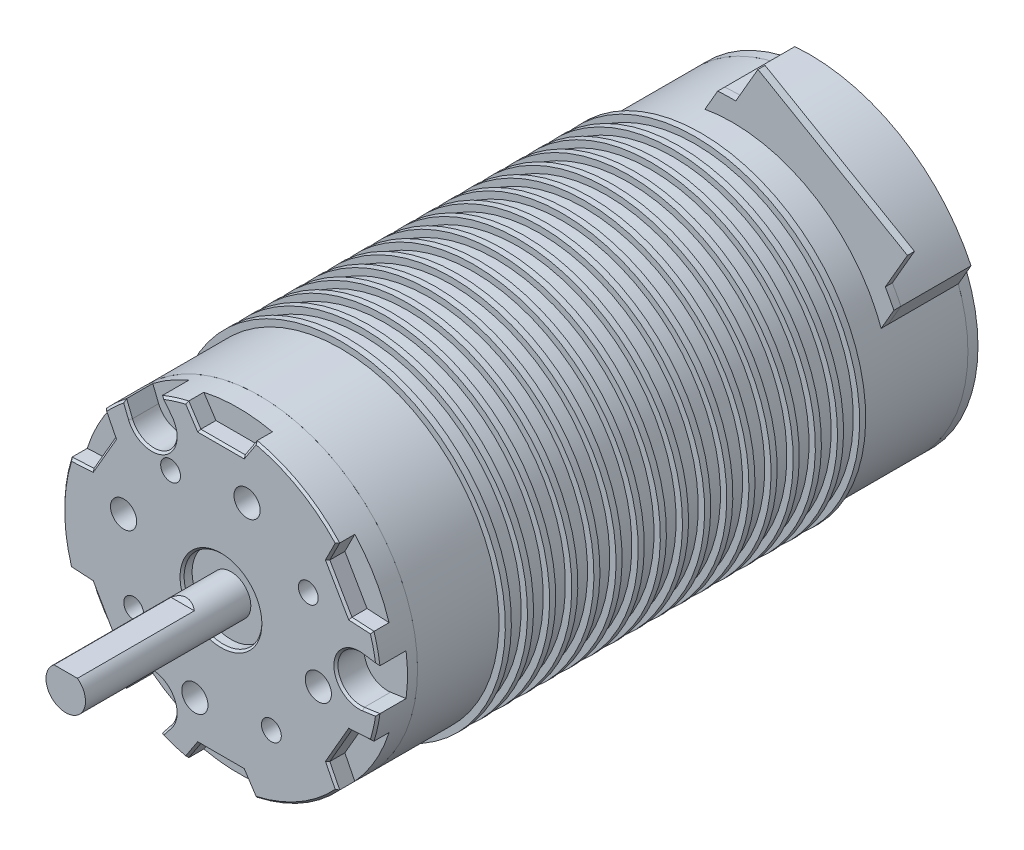
from build123d import *

# Parameters (mm, degrees)
SKETCH1_R                      = 19.939
BOSS_EXTRUDE1_DEPTH            = 69.342
SKETCH2_R                      = 19.939
BOSS_EXTRUDE2_DEPTH            = 1.27
SKETCH4_R                      = 19.939
BOSS_EXTRUDE3_DEPTH            = 4.826
CUT_EXTRUDE1_START             = -2.159
CUT_EXTRUDE1_DEPTH             = 2.159
CIRPATTERN1_COUNT              = 6
CUT_EXTRUDE2_START             = -3.556
CUT_EXTRUDE2_DEPTH             = 3.556
CIRPATTERN2_COUNT              = 3
SKETCH7_W                      = 0.762
SKETCH7_H                      = 0.8001
SKETCH8_R                      = 4.9022
CUT_EXTRUDE3_DEPTH             = 1.27
SKETCH9_R                      = 2.4892
BOSS_EXTRUDE4_DEPTH            = 20.828
CUT_EXTRUDE4_DEPTH             = 15.24
CHAMFER2_SIZE                  = 0.508
CHAMFER2_SIZE_2                = 0.526049399
CHAMFER3_SIZE                  = 0.254
CHAMFER3_SIZE2                 = 0.2630247
SKETCH12_W                     = 8.8392
SKETCH12_H                     = 2.54
REVOLVE2_ANGLE                 = 40
REVOLVE2_OTHER_WAY_ANGLE       = 40
CUT_EXTRUDE5_DEPTH             = 8.8392
BOSS_EXTRUDE5_DEPTH            = 0.889
M3X0_5_TAPPED_HOLE1_AT_2_COUNT = 2
M3X0_5_TAPPED_HOLE1_AT_2_PITCH = 17.960512242
M3X0_5_TAPPED_HOLE1_AT_3_COUNT = 2
M3X0_5_TAPPED_HOLE1_AT_3_PITCH = 25.4
M3X0_5_TAPPED_HOLE1_AT_4_COUNT = 2
M3X0_5_TAPPED_HOLE1_AT_4_PITCH = 17.960512242
M4X0_7_TAPPED_HOLE1_AT_2_COUNT = 2
M4X0_7_TAPPED_HOLE1_AT_2_PITCH = 17.960512242
M4X0_7_TAPPED_HOLE1_AT_3_COUNT = 2
M4X0_7_TAPPED_HOLE1_AT_3_PITCH = 25.4
M4X0_7_TAPPED_HOLE1_AT_4_COUNT = 2
M4X0_7_TAPPED_HOLE1_AT_4_PITCH = 17.960512242


with BuildPart() as part:
    # Sketch1 → Boss-Extrude1 (new body)
    with BuildSketch(Plane.XY):
        Circle(SKETCH1_R)
    extrude(amount=BOSS_EXTRUDE1_DEPTH)

    # Sketch7 → Revolve1 (revolve)
    with BuildSketch(Plane(origin=(0, 0, 0), x_dir=(0, 0, -1), z_dir=(1, 0, 0))):
        with Locations((-58.6994, 20.33905)):
            Rectangle(SKETCH7_W, SKETCH7_H)
        with Locations((-55.90936875, 20.33905)):
            Rectangle(SKETCH7_W, SKETCH7_H)
        with Locations((-53.1193375, 20.33905)):
            Rectangle(SKETCH7_W, SKETCH7_H)
        with Locations((-50.32930625, 20.33905)):
            Rectangle(SKETCH7_W, SKETCH7_H)
        with Locations((-47.539275, 20.33905)):
            Rectangle(SKETCH7_W, SKETCH7_H)
        with Locations((-44.74924375, 20.33905)):
            Rectangle(SKETCH7_W, SKETCH7_H)
        with Locations((-41.9592125, 20.33905)):
            Rectangle(SKETCH7_W, SKETCH7_H)
        with Locations((-39.16918125, 20.33905)):
            Rectangle(SKETCH7_W, SKETCH7_H)
        with Locations((-36.37915, 20.33905)):
            Rectangle(SKETCH7_W, SKETCH7_H)
        with Locations((-33.58911875, 20.33905)):
            Rectangle(SKETCH7_W, SKETCH7_H)
        with Locations((-30.7990875, 20.33905)):
            Rectangle(SKETCH7_W, SKETCH7_H)
        with Locations((-28.00905625, 20.33905)):
            Rectangle(SKETCH7_W, SKETCH7_H)
        with Locations((-25.219025, 20.33905)):
            Rectangle(SKETCH7_W, SKETCH7_H)
        with Locations((-22.42899375, 20.33905)):
            Rectangle(SKETCH7_W, SKETCH7_H)
        with Locations((-19.6389625, 20.33905)):
            Rectangle(SKETCH7_W, SKETCH7_H)
        with Locations((-16.84893125, 20.33905)):
            Rectangle(SKETCH7_W, SKETCH7_H)
        with Locations((-14.0589, 20.33905)):
            Rectangle(SKETCH7_W, SKETCH7_H)
    revolve(axis=Axis((0, 0, -1.27), (0, 0, 1)))


with BuildPart() as body_2:
    # Sketch2 → Boss-Extrude2 (new body)
    with BuildSketch(Plane(origin=(0, 0, 0), x_dir=(-1, 0, 0), z_dir=(0, 0, -1))):
        Circle(SKETCH2_R)
    extrude(amount=BOSS_EXTRUDE2_DEPTH)


with BuildPart() as body_3:
    # Sketch4 → Boss-Extrude3 (new body)
    with BuildSketch(Plane.XY.offset(69.342)):
        Circle(SKETCH4_R)
    extrude(amount=BOSS_EXTRUDE3_DEPTH)

    # Sketch5 → Cut-Extrude1 (cut)
    with BuildSketch(Plane.XY.offset(74.168).offset(CUT_EXTRUDE1_START)):
        with BuildLine():
            Line((-4.318, 19.465831526), (-2.794, 17.145))
            Line((-2.794, 17.145), (2.794, 17.145))
            Line((2.794, 17.145), (4.318, 19.465831526))
            ThreePointArc((4.318, 19.465831526), (0, 19.939), (-4.318, 19.465831526))
        make_face()
    cut_extrude1 = extrude(amount=CUT_EXTRUDE1_DEPTH, mode=Mode.SUBTRACT)

    # CirPattern1: Cut-Extrude1 ×6 about axis
    cirpattern1_axis = Axis((0, 0, 0), (0, 0, 1))
    for i in range(1, CIRPATTERN1_COUNT):
        add(cut_extrude1.rotate(cirpattern1_axis, i * 360 / CIRPATTERN1_COUNT), mode=Mode.SUBTRACT)

    # Sketch6 → Cut-Extrude2 (cut)
    with BuildSketch(Plane.XY.offset(74.168).offset(CUT_EXTRUDE2_START)):
        with BuildLine():
            Line((-12.14695744, 15.81186725), (-11.409591897, 13.978185694))
            ThreePointArc((-11.409591897, 13.978185694), (-7.239, 12.538315796), (-6.400667962, 16.870089276))
            Line((-6.400667962, 16.870089276), (-7.62, 18.425507347))
            ThreePointArc((-7.62, 18.425507347), (-9.9695, 17.267680526), (-12.14695744, 15.81186725))
        make_face()
    cut_extrude2 = extrude(amount=CUT_EXTRUDE2_DEPTH, mode=Mode.SUBTRACT)

    # CirPattern2: Cut-Extrude2 ×3 about axis
    cirpattern2_axis = Axis((0, 0, 0), (0, 0, 1))
    for i in range(1, CIRPATTERN2_COUNT):
        add(cut_extrude2.rotate(cirpattern2_axis, i * 360 / CIRPATTERN2_COUNT), mode=Mode.SUBTRACT)

    # Sketch8 → Cut-Extrude3 (cut)
    with BuildSketch(Plane.XY.offset(74.168)):
        Circle(SKETCH8_R)
    extrude(amount=-CUT_EXTRUDE3_DEPTH, mode=Mode.SUBTRACT)

    # Sketch9 → Boss-Extrude4 (add)
    with BuildSketch(Plane.XY.offset(72.898)):
        Circle(SKETCH9_R)
    extrude(amount=BOSS_EXTRUDE4_DEPTH)

    # Sketch10 → Cut-Extrude4 (cut)
    with BuildSketch(Plane.XY.offset(93.726)):
        with BuildLine():
            Line((-1.472981018, 2.0066), (1.472981018, 2.0066))
            ThreePointArc((1.472981018, 2.0066), (0, 2.4892), (-1.472981018, 2.0066))
        make_face()
    extrude(amount=-CUT_EXTRUDE4_DEPTH, mode=Mode.SUBTRACT)

    # Chamfer2
    # the kernel refuses this chamfer: 0.526049399, 0.508 mm, written as the material it adds along each edge
    with BuildSketch(Plane(origin=(-2.826438745, 2.0066, 78.486), x_dir=(0, -0.028950429899542527, 0.9995808484603093), z_dir=(1, 0, 0))) as chamfer2_piece_1_section:
        Polygon((CHAMFER2_SIZE * 0.99958084846, -CHAMFER2_SIZE * 0.0289504298995), (-CHAMFER2_SIZE_2 * 0.0289504299219, -CHAMFER2_SIZE_2 * 0.999580849231), (0, 0), align=None)
    chamfer2_piece_1 = extrude(amount=5.65287749, mode=Mode.PRIVATE)
    chamfer2_piece_1 = chamfer2_piece_1 & Plane(origin=(0, 0, 78.670866415), x_dir=(1, 0, 0), z_dir=(0, 0, -1)) * Cylinder(2.4892, 14, mode=Mode.PRIVATE)
    add(chamfer2_piece_1)

    # Chamfer3
    chamfer3_edges = [body_3.edges().sort_by_distance(p)[0] for p in [
        (-5.991621617, -19.017470689, 74.168),
        (19.465423541, 4.319838814, 74.168),
        (-11.778274668, -14.895026472, 74.168),
        (-3.556, 18.305415763, 74.168),
        (-7.010333981, -17.647798312, 74.168),
        (-7.239, -12.538315796, 74.168),
        (0, 17.145, 74.168),
        (18.788608649, -2.752771839, 74.168),
        (3.556, 18.305415763, 74.168),
        (18.788608649, 2.752771839, 74.168),
        (14.478, 0, 74.168),
        (-4.9022, 0, 74.168),
        (-19.939, 0, 74.168),
        (-13.473801924, -14.697631874, 74.168),
        (9.9695, -17.267680526, 74.168),
        (19.465423541, -4.319838814, 74.168),
        (9.9695, 17.267680526, 74.168),
        (14.074955078, 12.232294217, 74.168),
        (14.848005548, 8.5725, 74.168),
        (17.630955078, 6.073121546, 74.168),
        (17.630955078, -6.073121546, 74.168),
        (14.848005548, -8.5725, 74.168),
        (14.074955078, -12.232294217, 74.168),
        (3.556, -18.305415763, 74.168),
        (0, -17.145, 74.168),
        (-3.556, -18.305415763, 74.168),
        (-14.074955078, -12.232294217, 74.168),
        (-14.848005548, -8.5725, 74.168),
        (-17.630955078, -6.073121546, 74.168),
        (-5.991621617, 19.017470689, 74.168),
        (-17.630955078, 6.073121546, 74.168),
        (-14.848005548, 8.5725, 74.168),
        (-14.074955078, 12.232294217, 74.168),
        (-13.473801924, 14.697631874, 74.168),
        (-7.010333981, 17.647798312, 74.168),
        (-11.778274668, 14.895026472, 74.168),
        (-7.239, 12.538315796, 74.168),
    ]]
    chamfer3_side = [body_3.faces().sort_by_distance(p)[0] for p in [
        (-4.020820912, 18.000185908, 74.168),
    ]]
    chamfer(chamfer3_edges, length=CHAMFER3_SIZE, length2=CHAMFER3_SIZE2, reference=chamfer3_side[0])


with BuildPart() as body_4:
    # Sketch12 → Revolve2 (revolve)
    with BuildSketch(Plane(origin=(0, 0, 0), x_dir=(0, 0, -1), z_dir=(0.8660254037844382, -0.500000000000001, 1.8914997310486246e-15))):
        with Locations((-4.4196, 21.209)):
            Rectangle(SKETCH12_W, SKETCH12_H)
    revolve(axis=Axis((0, 0, 0), (0, 0, 1)), revolution_arc=REVOLVE2_ANGLE)

    # Sketch12 → Revolve2 other way (revolve)
    with BuildSketch(Plane(origin=(0, 0, 0), x_dir=(0, 0, -1), z_dir=(0.8660254037844382, -0.500000000000001, 1.8914997310486246e-15))):
        with Locations((-4.4196, 21.209)):
            Rectangle(SKETCH12_W, SKETCH12_H)
    revolve(axis=Axis((0, 0, 0), (0, 0, -1)), revolution_arc=REVOLVE2_OTHER_WAY_ANGLE)

    # Sketch13 → Cut-Extrude5 (cut)
    with BuildSketch(Plane(origin=(0, 0, 0), x_dir=(-1, 0, 0), z_dir=(0, 0, -1))):
        with BuildLine():
            Line((-18.736531166, 6.819539638), (-20.333108117, 9.584892035))
            ThreePointArc((-20.333108117, 9.584892035), (-20.749910402, 8.645615034), (-21.123350423, 7.688270802))
            Line((-21.123350423, 7.688270802), (-18.736531166, 6.819539638))
        make_face()
        with BuildLine():
            Line((3.462371015, 19.636081787), (1.865794064, 22.401434184))
            ThreePointArc((1.865794064, 22.401434184), (2.88763295, 22.292757051), (3.903437386, 22.13749348))
            Line((3.903437386, 22.13749348), (3.462371015, 19.636081787))
        make_face()
    extrude(amount=-CUT_EXTRUDE5_DEPTH, mode=Mode.SUBTRACT)


with BuildPart() as body_5:
    # Sketch14 → Boss-Extrude5 (new body)
    with BuildSketch(Plane.XY.offset(8.8392)):
        with BuildLine():
            Line((-3.462371015, 19.636081787), (-1.865794064, 22.401434184))
            ThreePointArc((-1.865794064, 22.401434184), (-0.723731232, 22.467346397), (0.420205936, 22.475072146))
            Line((0.420205936, 22.475072146), (3.214205936, 27.314422102))
            Line((3.214205936, 27.314422102), (22.047880462, 16.440795045))
            Line((22.047880462, 16.440795045), (19.253880462, 11.601445089))
            ThreePointArc((19.253880462, 11.601445089), (19.819158351, 10.606903566), (20.333108117, 9.584892035))
            Line((20.333108117, 9.584892035), (18.736531166, 6.819539638))
            ThreePointArc((18.736531166, 6.819539638), (9.9695, 17.267680526), (-3.462371015, 19.636081787))
        make_face()
    extrude(amount=BOSS_EXTRUDE5_DEPTH)


with BuildPart() as m3x0_5_tapped_hole1_tool:
    # Sketch17 → M3x0.5 Tapped Hole1 (revolve)
    with BuildSketch(Plane(origin=(-6.35, 10.998522628, 74.168), x_dir=(0, -1, 0), z_dir=(1, 0, 0))):
        Polygon((0, 0), (0, 7.62), (1.25, 6.868924226), (1.25, 0), align=None)
    m3x0_5_tapped_hole1 = revolve(axis=Axis((-6.35, 10.998522628, 80.518), (0, 0, -1)))


with BuildPart() as part_1:
    add(part.part)

    # M3x0.5 Tapped Hole1: cut by m3x0_5_tapped_hole1_tool
    add(m3x0_5_tapped_hole1_tool.part, mode=Mode.SUBTRACT)


with BuildPart() as body_3_1:
    add(body_3.part)

    # M3x0.5 Tapped Hole1: cut by m3x0_5_tapped_hole1_tool
    add(m3x0_5_tapped_hole1_tool.part, mode=Mode.SUBTRACT)


with BuildPart() as m3x0_5_tapped_hole1_at_2_tool:
    # M3x0.5 Tapped Hole1 at 2: M3x0.5 Tapped Hole1 ×2
    with Locations(*[Vector(0.9659258262890685, -0.25881904510251963, 0) * (i * M3X0_5_TAPPED_HOLE1_AT_2_PITCH) for i in range(1, M3X0_5_TAPPED_HOLE1_AT_2_COUNT)]):
        add(m3x0_5_tapped_hole1)


with BuildPart() as part_2:
    add(part_1.part)

    # M3x0.5 Tapped Hole1 at 2: cut by m3x0_5_tapped_hole1_at_2_tool
    add(m3x0_5_tapped_hole1_at_2_tool.part, mode=Mode.SUBTRACT)


with BuildPart() as body_3_2:
    add(body_3_1.part)

    # M3x0.5 Tapped Hole1 at 2: cut by m3x0_5_tapped_hole1_at_2_tool
    add(m3x0_5_tapped_hole1_at_2_tool.part, mode=Mode.SUBTRACT)


with BuildPart() as m3x0_5_tapped_hole1_at_3_tool:
    # M3x0.5 Tapped Hole1 at 3: M3x0.5 Tapped Hole1 ×2
    with Locations(*[Vector(0.500000000000001, -0.866025403784438, 0) * (i * M3X0_5_TAPPED_HOLE1_AT_3_PITCH) for i in range(1, M3X0_5_TAPPED_HOLE1_AT_3_COUNT)]):
        add(m3x0_5_tapped_hole1)


with BuildPart() as part_3:
    add(part_2.part)

    # M3x0.5 Tapped Hole1 at 3: cut by m3x0_5_tapped_hole1_at_3_tool
    add(m3x0_5_tapped_hole1_at_3_tool.part, mode=Mode.SUBTRACT)


with BuildPart() as body_3_3:
    add(body_3_2.part)

    # M3x0.5 Tapped Hole1 at 3: cut by m3x0_5_tapped_hole1_at_3_tool
    add(m3x0_5_tapped_hole1_at_3_tool.part, mode=Mode.SUBTRACT)


with BuildPart() as m3x0_5_tapped_hole1_at_4_tool:
    # M3x0.5 Tapped Hole1 at 4: M3x0.5 Tapped Hole1 ×2
    with Locations(*[Vector(-0.2588190451025195, -0.9659258262890686, 0) * (i * M3X0_5_TAPPED_HOLE1_AT_4_PITCH) for i in range(1, M3X0_5_TAPPED_HOLE1_AT_4_COUNT)]):
        add(m3x0_5_tapped_hole1)


with BuildPart() as part_4:
    add(part_3.part)

    # M3x0.5 Tapped Hole1 at 4: cut by m3x0_5_tapped_hole1_at_4_tool
    add(m3x0_5_tapped_hole1_at_4_tool.part, mode=Mode.SUBTRACT)


with BuildPart() as body_3_4:
    add(body_3_3.part)

    # M3x0.5 Tapped Hole1 at 4: cut by m3x0_5_tapped_hole1_at_4_tool
    add(m3x0_5_tapped_hole1_at_4_tool.part, mode=Mode.SUBTRACT)


with BuildPart() as m4x0_7_tapped_hole1_tool:
    # Sketch19 → M4x0.7 Tapped Hole1 (revolve)
    with BuildSketch(Plane(origin=(3.287001873, 12.267257994, 74.168), x_dir=(0, -1, 0), z_dir=(1, 0, 0))):
        Polygon((0, 0), (0, 9.906), (1.65, 8.914579979), (1.65, 0), align=None)
    m4x0_7_tapped_hole1 = revolve(axis=Axis((3.287001873, 12.267257994, 80.518), (0, 0, -1)))


with BuildPart() as part_5:
    add(part_4.part)

    # M4x0.7 Tapped Hole1: cut by m4x0_7_tapped_hole1_tool
    add(m4x0_7_tapped_hole1_tool.part, mode=Mode.SUBTRACT)


with BuildPart() as body_3_5:
    add(body_3_4.part)

    # M4x0.7 Tapped Hole1: cut by m4x0_7_tapped_hole1_tool
    add(m4x0_7_tapped_hole1_tool.part, mode=Mode.SUBTRACT)


with BuildPart() as m4x0_7_tapped_hole1_at_2_tool:
    # M4x0.7 Tapped Hole1 at 2: M4x0.7 Tapped Hole1 ×2
    with Locations(*[Vector(0.5000000000000009, -0.8660254037844382, 0) * (i * M4X0_7_TAPPED_HOLE1_AT_2_PITCH) for i in range(1, M4X0_7_TAPPED_HOLE1_AT_2_COUNT)]):
        add(m4x0_7_tapped_hole1)


with BuildPart() as part_6:
    add(part_5.part)

    # M4x0.7 Tapped Hole1 at 2: cut by m4x0_7_tapped_hole1_at_2_tool
    add(m4x0_7_tapped_hole1_at_2_tool.part, mode=Mode.SUBTRACT)


with BuildPart() as body_3_6:
    add(body_3_5.part)

    # M4x0.7 Tapped Hole1 at 2: cut by m4x0_7_tapped_hole1_at_2_tool
    add(m4x0_7_tapped_hole1_at_2_tool.part, mode=Mode.SUBTRACT)


with BuildPart() as m4x0_7_tapped_hole1_at_3_tool:
    # M4x0.7 Tapped Hole1 at 3: M4x0.7 Tapped Hole1 ×2
    with Locations(*[Vector(-0.25881904510251963, -0.9659258262890686, 0) * (i * M4X0_7_TAPPED_HOLE1_AT_3_PITCH) for i in range(1, M4X0_7_TAPPED_HOLE1_AT_3_COUNT)]):
        add(m4x0_7_tapped_hole1)


with BuildPart() as part_7:
    add(part_6.part)

    # M4x0.7 Tapped Hole1 at 3: cut by m4x0_7_tapped_hole1_at_3_tool
    add(m4x0_7_tapped_hole1_at_3_tool.part, mode=Mode.SUBTRACT)


with BuildPart() as body_3_7:
    add(body_3_6.part)

    # M4x0.7 Tapped Hole1 at 3: cut by m4x0_7_tapped_hole1_at_3_tool
    add(m4x0_7_tapped_hole1_at_3_tool.part, mode=Mode.SUBTRACT)


with BuildPart() as m4x0_7_tapped_hole1_at_4_tool:
    # M4x0.7 Tapped Hole1 at 4: M4x0.7 Tapped Hole1 ×2
    with Locations(*[Vector(-0.8660254037844382, -0.5000000000000009, 0) * (i * M4X0_7_TAPPED_HOLE1_AT_4_PITCH) for i in range(1, M4X0_7_TAPPED_HOLE1_AT_4_COUNT)]):
        add(m4x0_7_tapped_hole1)


with BuildPart() as part_8:
    add(part_7.part)

    # M4x0.7 Tapped Hole1 at 4: cut by m4x0_7_tapped_hole1_at_4_tool
    add(m4x0_7_tapped_hole1_at_4_tool.part, mode=Mode.SUBTRACT)


with BuildPart() as body_3_8:
    add(body_3_7.part)

    # M4x0.7 Tapped Hole1 at 4: cut by m4x0_7_tapped_hole1_at_4_tool
    add(m4x0_7_tapped_hole1_at_4_tool.part, mode=Mode.SUBTRACT)


solid = Compound([body_2.part, body_4.part, body_5.part, part_8.part, body_3_8.part])
